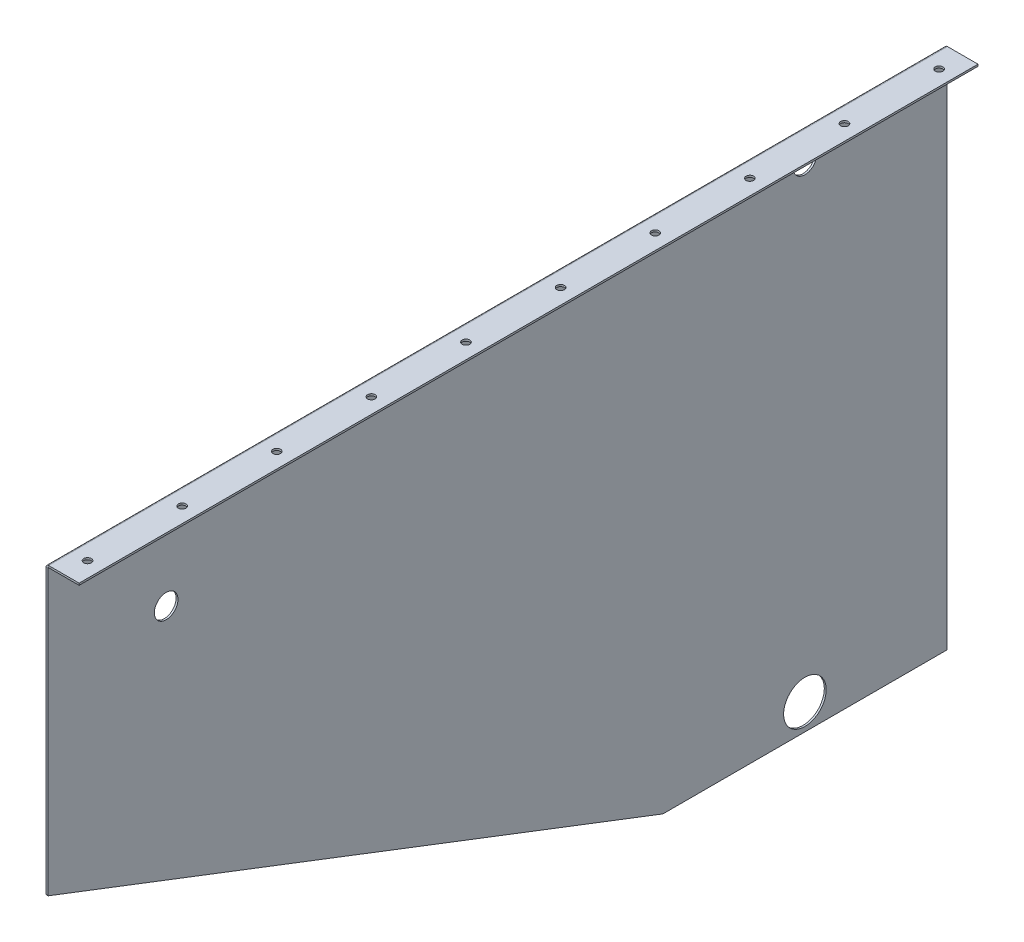
from build123d import *

# Parameters (mm, degrees)
BASE_FLANGE1_DEPTH     = 2
TAB1_START             = -2
TAB1_OUTLINE_W         = 950
TAB1_OUTLINE_H         = 35
TAB1_DEPTH             = 2
SKETCHED_START         = -950
SKETCHED_BEND1_DEPTH   = 950
SKETCHED_BEND1_2_DEPTH = 950
FILLET1_R              = 0.78
FILLET2_R              = 0.74
SKETCH10_R             = 12.5
SKETCH10_R_2           = 22.5
CUT_EXTRUDE1_DEPTH     = 10
SKETCH11_R             = 4
CUT_EXTRUDE2_DEPTH     = 10
SKETCH12_R             = 12.5
CUT_EXTRUDE3_DEPTH     = 10


# Read off the part's stored shape, not the designer's step: Tab1, Sketched Bend1
# Sheet-metal steps are written as plain solids
with BuildPart() as part:
    # Sketch1 → Base-Flange1 (new body)
    with BuildSketch(Plane(origin=(0, 0, 0), x_dir=(0, 0, -1), z_dir=(1, 0, 0))):
        Polygon((0, 0), (0, -300), (650, -550), (950, -550), (950, 0), align=None)
    extrude(amount=-BASE_FLANGE1_DEPTH)

    # Tab1 outline → Tab1 (add)
    with BuildSketch(Plane(origin=(0, 0, 0), x_dir=(0, 0, -1), z_dir=(1, 0, 0)).offset(TAB1_START)):
        with Locations((475, 17.5)):
            Rectangle(TAB1_OUTLINE_W, TAB1_OUTLINE_H)
    extrude(amount=TAB1_DEPTH)

    # Sketched Bend1 outline → Sketched Bend1 (cut)
    with BuildSketch(Plane.XY.offset(SKETCHED_START)):
        with BuildLine():
            ThreePointArc((-2, 0), (-1.443395312, 1.654267209), (0, 2.635602398))
            Line((0, 2.635602398), (0, 35))
            Line((0, 35), (-2, 35))
            Line((-2, 35), (-2, 0))
        make_face()
    extrude(amount=SKETCHED_BEND1_DEPTH, mode=Mode.SUBTRACT)

    # Sketched Bend1 2 outline → Sketched Bend1 2 (add)
    with BuildSketch(Plane.XY.offset(SKETCHED_START)):
        with BuildLine():
            Line((33.008755099, 2.7366), (0.7366, 2.7366))
            ThreePointArc((0.7366, 2.7366), (0.364854094, 2.711233029), (0, 2.635602398))
            Line((0, 2.635602398), (0, 0))
            ThreePointArc((0, 0), (0.215745145, 0.520854855), (0.7366, 0.7366))
            Line((0.7366, 0.7366), (33.008755099, 0.7366))
            Line((33.008755099, 0.7366), (33.008755099, 2.7366))
        make_face()
    extrude(amount=SKETCHED_BEND1_2_DEPTH)

    # Fillet1
    fillet1_edges = [part.edges().sort_by_distance(p)[0] for p in [
        (-1, -300, 0),
    ]]
    fillet(fillet1_edges, radius=FILLET1_R)

    # Fillet2
    fillet2_edges = [part.edges().sort_by_distance(p)[0] for p in [
        (-1, -550, -650),
    ]]
    fillet(fillet2_edges, radius=FILLET2_R)

    # Sketch10 → Cut-Extrude1 (cut)
    with BuildSketch(Plane(origin=(0, 0, 0), x_dir=(0, 0, -1), z_dir=(1, 0, 0))):
        with Locations((800.068700733, -27.5)):
            Circle(SKETCH10_R)
        with Locations((800.068700733, -522.5)):
            Circle(SKETCH10_R_2)
    extrude(amount=-CUT_EXTRUDE1_DEPTH, mode=Mode.SUBTRACT)

    # Sketch11 → Cut-Extrude2 (cut)
    with BuildSketch(Plane.XZ.offset(-0.7366)):
        with Locations((16.872677549, -25)):
            Circle(SKETCH11_R)
        with Locations((16.872677549, -125)):
            Circle(SKETCH11_R)
        with Locations((16.872677549, -225)):
            Circle(SKETCH11_R)
        with Locations((16.872677549, -325)):
            Circle(SKETCH11_R)
        with Locations((16.872677549, -425)):
            Circle(SKETCH11_R)
        with Locations((16.872677549, -525)):
            Circle(SKETCH11_R)
        with Locations((16.872677549, -625)):
            Circle(SKETCH11_R)
        with Locations((16.872677549, -725)):
            Circle(SKETCH11_R)
        with Locations((16.872677549, -825)):
            Circle(SKETCH11_R)
        with Locations((16.872677549, -925)):
            Circle(SKETCH11_R)
    extrude(amount=-CUT_EXTRUDE2_DEPTH, mode=Mode.SUBTRACT)

    # Sketch12 → Cut-Extrude3 (cut)
    with BuildSketch(Plane(origin=(0, 0, 0), x_dir=(0, 0, -1), z_dir=(1, 0, 0))):
        with Locations((125, -97.2634)):
            Circle(SKETCH12_R)
    extrude(amount=-CUT_EXTRUDE3_DEPTH, mode=Mode.SUBTRACT)


solid = part.part
